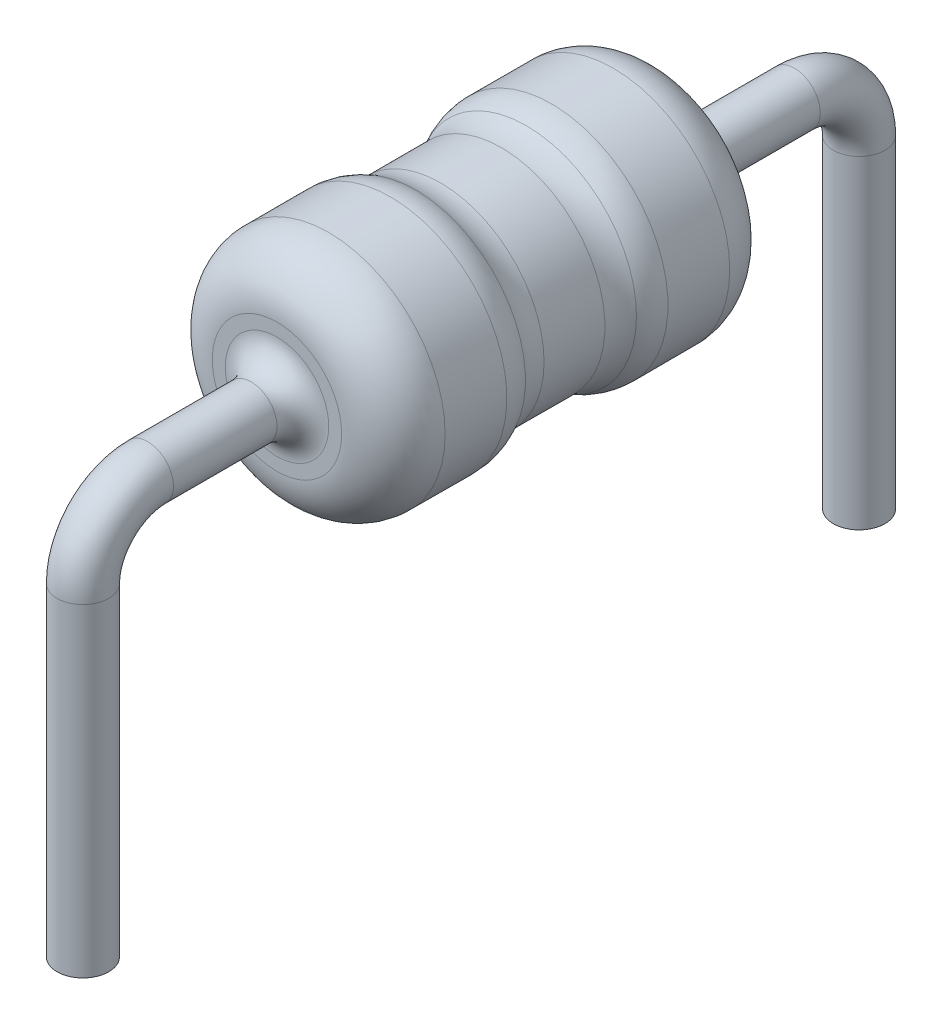
from build123d import *

# Parameters (mm, degrees)
IZIM1_R                     = 0.9
Y_KSEKLIK_EKSTR_ZYON1_DEPTH = 1
IZIM2_R                     = 0.8
Y_KSEKLIK_EKSTR_ZYON2_DEPTH = 1
IZIM3_R                     = 0.9
Y_KSEKLIK_EKSTR_ZYON3_DEPTH = 1
IZIM5_R                     = 0.2
IZIM7_R                     = 0.2
RADYUS1_R                   = 0.4
RADYUS2_R                   = 0.4
RADYUS3_R                   = 0.4
RADYUS4_R                   = 0.2
RADYUS5_R                   = 0.2


with BuildPart() as part:
    # Çizim1 → Yükseklik-Ekstrüzyon1 (new body)
    with BuildSketch(Plane.XY):
        Circle(IZIM1_R)
    extrude(amount=Y_KSEKLIK_EKSTR_ZYON1_DEPTH)

    # Çizim2 → Yükseklik-Ekstrüzyon2 (add)
    with BuildSketch(Plane.XY.offset(1)):
        Circle(IZIM2_R)
    extrude(amount=Y_KSEKLIK_EKSTR_ZYON2_DEPTH)

    # Çizim3 → Yükseklik-Ekstrüzyon3 (add)
    with BuildSketch(Plane.XY.offset(2)):
        Circle(IZIM3_R)
    extrude(amount=Y_KSEKLIK_EKSTR_ZYON3_DEPTH)

    # Süpür1: sweep along a path in Çizim4
    with BuildLine(Plane(origin=(0, 0, 0), x_dir=(0, 0, -1), z_dir=(1, 0, 0))) as s_p_r1_path:
        Line((-2.815333461, 0), (-4, 0))
        ThreePointArc((-4, 0), (-4.353553391, -0.146446609), (-4.5, -0.5))
        Line((-4.5, -0.5), (-4.5, -3))
    # Çizim5 → Süpür1 (sweep)
    with BuildSketch(Plane.XY.offset(2.815333461)):
        Circle(IZIM5_R)
    sweep(path=s_p_r1_path.line)

    # Süpür2: sweep along a path in Çizim6
    with BuildLine(Plane(origin=(0, 0, 0), x_dir=(0, 0, -1), z_dir=(1, 0, 0))) as s_p_r2_path:
        Line((-0.354844332, 0), (1, 0))
        ThreePointArc((1, 0), (1.353553391, -0.146446609), (1.5, -0.5))
        Line((1.5, -0.5), (1.5, -3))
    # Çizim7 → Süpür2 (sweep)
    with BuildSketch(Plane(origin=(0, 0, 0.354844332), x_dir=(-1, 0, 0), z_dir=(0, 0, -1))):
        Circle(IZIM7_R)
    sweep(path=s_p_r2_path.line)

    # Radyus1
    # the kernel refuses this fillet: 0.4 mm, written as the material it adds along each edge
    with BuildSketch(Plane(origin=(0, 0, 1), x_dir=(1, 0, 0), z_dir=(0, -1, 0))) as radyus1_piece_1:
        with BuildLine():
            CenterArc((1.2, 0.264575131), RADYUS1_R, 180, 41.409622109)
            Line((0.9, 0), (0.894, -0.005291503))
            ThreePointArc((0.894, -0.005291503), (0.85, -0.008), (0.8, -0.008))
            Line((0.8, -0.008), (0.792, 0))
            Line((0.792, 0), (0.792, 0.264575131))
            Line((0.792, 0.264575131), (0.8, 0.264575131))
        make_face()
    revolve(axis=Axis((0, 0, 1), (0, 0, 1)))
    with BuildSketch(Plane(origin=(0, 0, 2), x_dir=(1, 0, 0), z_dir=(0, -1, 0))) as radyus1_piece_2:
        with BuildLine():
            CenterArc((1.2, -0.264575131), RADYUS1_R, 138.590377891, 41.409622109)
            Line((0.8, -0.264575131), (0.792, -0.264575131))
            Line((0.792, -0.264575131), (0.792, 0))
            Line((0.792, 0), (0.8, 0.008))
            ThreePointArc((0.8, 0.008), (0.85, 0.008), (0.894, 0.005291503))
            Line((0.894, 0.005291503), (0.9, 0))
        make_face()
    revolve(axis=Axis((0, 0, 2), (0, 0, 1)))

    # Radyus2
    radyus2_edges = [part.edges().sort_by_distance(p)[0] for p in [
        (-0.9, 0, 0),
        (-0.9, 0, 1),
    ]]
    fillet(radyus2_edges, radius=RADYUS2_R)

    # Radyus3
    radyus3_edges = [part.edges().sort_by_distance(p)[0] for p in [
        (-0.9, 0, 2),
        (-0.9, 0, 3),
    ]]
    fillet(radyus3_edges, radius=RADYUS3_R)

    # Radyus4
    radyus4_edges = [part.edges().sort_by_distance(p)[0] for p in [
        (-0.2, 0, 3),
    ]]
    fillet(radyus4_edges, radius=RADYUS4_R)

    # Radyus5
    radyus5_edges = [part.edges().sort_by_distance(p)[0] for p in [
        (0.2, 0, 0),
    ]]
    fillet(radyus5_edges, radius=RADYUS5_R)


solid = part.part
